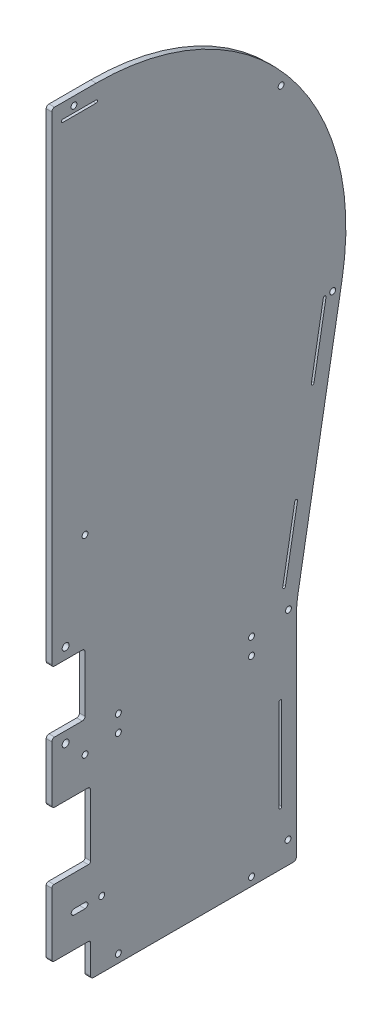
from build123d import *

# Parameters (mm, degrees)
BOSS_EXTRUDE1_DEPTH             = 6.35
F_1_4_CLEARANCE_HOLE1_D         = 6.7564
CUT_EXTRUDE1_DEPTH              = 929.886717725
FILLET1_R                       = 3.175
SKETCH5_W                       = 44.45
SKETCH5_H                       = 76.2
BOSS_EXTRUDE2_DEPTH             = 6.35
FILLET2_R                       = 2.54
F_1_4_0_25_DIAMETER_SLOT1_DEPTH = 6.35
F_5_16_0_3125_DIAMETER_HOLE1_D  = 7.9375


# Read off the part's stored shape, not the designer's step: 1/4 (0.25) Diameter Slot1
with BuildPart() as part:
    # Sketch1 → Boss-Extrude1 (new body)
    with BuildSketch(Plane(origin=(0, 0, 0), x_dir=(0, 0, -1), z_dir=(1, 0, 0))):
        with BuildLine():
            Line((0, 19.05), (50.8, 19.05))
            ThreePointArc((50.8, 19.05), (269.697199621, -83.023440532), (332.208815423, -316.319966768))
            Line((332.208815423, -316.319966768), (281.874321133, -601.781069134))
            ThreePointArc((281.874321133, -601.781069134), (280.337795232, -613.452142071), (279.824317306, -625.212720108))
            Line((279.824317306, -625.212720108), (279.824317306, -865.750720108))
            Line((279.824317306, -865.750720108), (44.45, -865.750720108))
            Line((44.45, -865.750720108), (44.45, -674.7002))
            Line((44.45, -674.7002), (0, -674.7002))
            Line((0, -674.7002), (0, -605.1296))
            Line((0, -605.1296), (38.1, -605.1296))
            Line((38.1, -605.1296), (38.1, -534.7716))
            Line((38.1, -534.7716), (0, -534.7716))
            Line((0, -534.7716), (0, 19.05))
        make_face()
    extrude(amount=BOSS_EXTRUDE1_DEPTH)

    # 1/4 Clearance Hole1 (through all)
    with Locations(Plane(origin=(6.35, 0, 0), x_dir=(0, 0, -1), z_dir=(1, 0, 0))):
        with Locations((25.4, 9.525), (262.400626301, -89.145992514), (321.450189166, -322.482879416), (270.849040732, -612.621983621), (270.299317306, -840.350720108), (38.1, -639.9149), (38.1, -422.275), (76.2, -637.430120108), (228.6, -637.430120108), (76.2, -856.225720108), (228.6, -856.225720108), (228.6, -618.380120108), (76.2, -618.380120108), (57.15, -789.550720108)):
            Hole(F_1_4_CLEARANCE_HOLE1_D / 2)

    # Sketch4 → Cut-Extrude1 (cut, through all)
    with BuildSketch(Plane(origin=(6.35, 0, 0), x_dir=(0, 0, -1), z_dir=(1, 0, 0))):
        with BuildLine():
            Line((50.8, -0.79375), (12.7, -0.79375))
            ThreePointArc((12.7, -0.79375), (11.1125, 0.79375), (12.7, 2.38125))
            Line((12.7, 2.38125), (50.8, 2.38125))
            ThreePointArc((50.8, 2.38125), (52.3875, 0.79375), (50.8, -0.79375))
        make_face()
        with BuildLine():
            Line((313.863635816, -324.369144862), (300.080311714, -402.538260258))
            ThreePointArc((300.080311714, -402.538260258), (298.241262924, -403.825976083), (296.953547098, -401.986927293))
            Line((296.953547098, -401.986927293), (310.7368712, -323.817811898))
            ThreePointArc((310.7368712, -323.817811898), (312.57591999, -322.530096072), (313.863635816, -324.369144862))
        make_face()
        with BuildLine():
            Line((267.388472275, -587.942894917), (281.171796377, -509.773779521))
            ThreePointArc((281.171796377, -509.773779521), (279.884080551, -507.934730732), (278.045031761, -509.222446557))
            Line((278.045031761, -509.222446557), (264.261707659, -587.391561953))
            ThreePointArc((264.261707659, -587.391561953), (265.549423485, -589.230610743), (267.388472275, -587.942894917))
        make_face()
        with BuildLine():
            Line((259.980567306, -803.838220108), (259.980567306, -699.063220108))
            ThreePointArc((259.980567306, -699.063220108), (261.568067306, -697.475720108), (263.155567306, -699.063220108))
            Line((263.155567306, -699.063220108), (263.155567306, -803.838220108))
            ThreePointArc((263.155567306, -803.838220108), (261.568067306, -805.425720108), (259.980567306, -803.838220108))
        make_face()
    extrude(amount=-CUT_EXTRUDE1_DEPTH, mode=Mode.SUBTRACT)

    # Fillet1
    fillet1_edges = [part.edges().sort_by_distance(p)[0] for p in [
        (3.175, -605.1296, -38.1),
        (3.175, -534.7716, -38.1),
        (3.175, -534.7716, 0),
        (3.175, 19.05, 0),
        (3.175, -865.750720108, -279.824317306),
        (3.175, -865.750720108, -44.45),
        (3.175, -674.7002, -44.45),
        (3.175, -674.7002, 0),
        (3.175, -605.1296, 0),
    ]]
    fillet(fillet1_edges, radius=FILLET1_R)

    # Sketch5 → Boss-Extrude2 (add)
    with BuildSketch(Plane(origin=(6.35, 0, 0), x_dir=(0, 0, -1), z_dir=(1, 0, 0))):
        with Locations((22.225, -789.0002)):
            Rectangle(SKETCH5_W, SKETCH5_H)
    extrude(amount=-BOSS_EXTRUDE2_DEPTH)

    # Fillet2
    fillet2_edges = [part.edges().sort_by_distance(p)[0] for p in [
        (3.175, -750.9002, -44.45),
        (3.175, -827.1002, -44.45),
        (3.175, -827.1002, 0),
        (3.175, -750.9002, 0),
    ]]
    fillet(fillet2_edges, radius=FILLET2_R)

    # 1/4 (0.25) Diameter Slot1 outline → 1/4 (0.25) Diameter Slot1 (cut)
    with BuildSketch(Plane.YZ):
        with BuildLine():
            Line((-786.375720108, -38.1), (-786.375720108, -25.4))
            ThreePointArc((-786.375720108, -25.4), (-789.550720108, -22.225), (-792.725720108, -25.4))
            Line((-792.725720108, -25.4), (-792.725720108, -38.1))
            ThreePointArc((-792.725720108, -38.1), (-789.550720108, -41.275), (-786.375720108, -38.1))
        make_face()
    extrude(amount=F_1_4_0_25_DIAMETER_SLOT1_DEPTH, mode=Mode.SUBTRACT)

    # 5/16 (0.3125) Diameter Hole1 (through all)
    with Locations(Plane(origin=(6.35, 0, 0), x_dir=(0, 0, -1), z_dir=(1, 0, 0))):
        with Locations((15.875, -522.0716), (15.875, -617.8296)):
            Hole(F_5_16_0_3125_DIAMETER_HOLE1_D / 2)


solid = part.part
